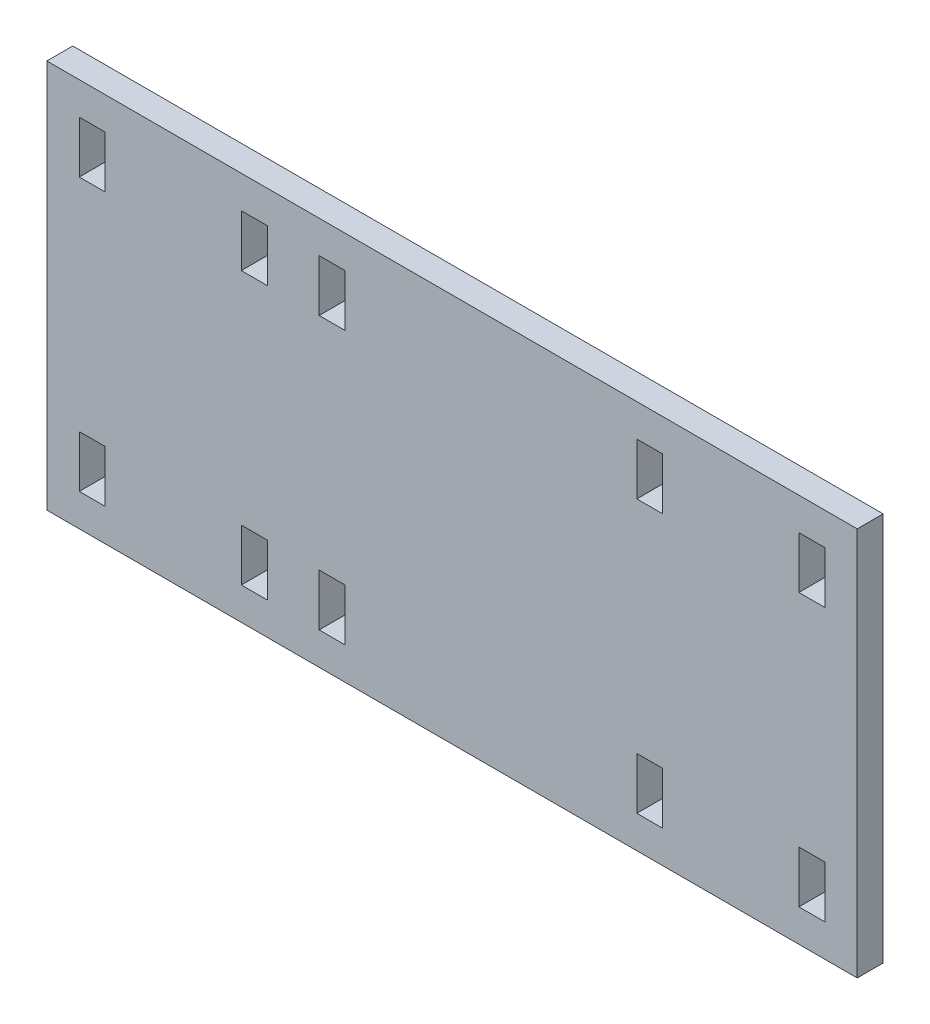
from build123d import *

# Parameters (mm, degrees)
SKETCH1_W           = 125
SKETCH1_H           = 60
SKETCH1_W_2         = 4
SKETCH1_H_2         = 8
BOSS_EXTRUDE1_DEPTH = 4


with BuildPart() as part:
    # Sketch1 → Boss-Extrude1 (new body)
    with BuildSketch(Plane.XY):
        with Locations((-6, 0)):
            Rectangle(SKETCH1_W, SKETCH1_H)
        with Locations((-36.5, 21)):
            Rectangle(SKETCH1_W_2, SKETCH1_H_2, mode=Mode.SUBTRACT)
        with Locations((24.5, 21)):
            Rectangle(SKETCH1_W_2, SKETCH1_H_2, mode=Mode.SUBTRACT)
        with Locations((24.5, -21)):
            Rectangle(SKETCH1_W_2, SKETCH1_H_2, mode=Mode.SUBTRACT)
        with Locations((-24.5, 21)):
            Rectangle(SKETCH1_W_2, SKETCH1_H_2, mode=Mode.SUBTRACT)
        with Locations((-24.5, -21)):
            Rectangle(SKETCH1_W_2, SKETCH1_H_2, mode=Mode.SUBTRACT)
        with Locations((49.5, 21)):
            Rectangle(SKETCH1_W_2, SKETCH1_H_2, mode=Mode.SUBTRACT)
        with Locations((49.5, -21)):
            Rectangle(SKETCH1_W_2, SKETCH1_H_2, mode=Mode.SUBTRACT)
        with Locations((-36.5, -21)):
            Rectangle(SKETCH1_W_2, SKETCH1_H_2, mode=Mode.SUBTRACT)
        with Locations((-61.5, 21)):
            Rectangle(SKETCH1_W_2, SKETCH1_H_2, mode=Mode.SUBTRACT)
        with Locations((-61.5, -21)):
            Rectangle(SKETCH1_W_2, SKETCH1_H_2, mode=Mode.SUBTRACT)
    extrude(amount=BOSS_EXTRUDE1_DEPTH)


solid = part.part
